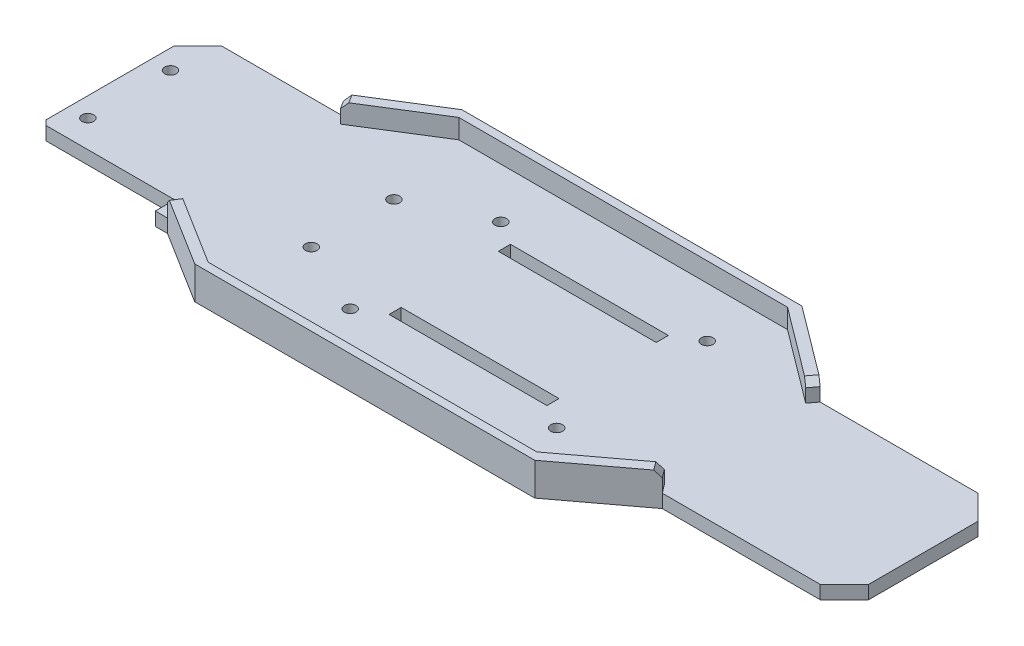
from build123d import *

# Parameters (mm, degrees)
BOSS_EXTRUDE1_DEPTH  = 5.5
CHASSIS_WALLS1_DEPTH = 8
CHAMFER1_SIZE        = 10
CHAMFER2_SIZE        = 10
CHAMFER3_SIZE        = 2.5
SKETCH4_R            = 2.4
CUT_EXTRUDE1_DEPTH   = 10
SKETCH5_W            = 55
SKETCH5_H            = 8
CUT_EXTRUDE2_DEPTH   = 10
SKETCH6_W            = 65
SKETCH6_H            = 5
CUT_EXTRUDE3_DEPTH   = 184.613724977


with BuildPart() as part:
    # Sketch1 → Boss-Extrude1 (new body)
    with BuildSketch(Plane(origin=(0, 0, 0), x_dir=(1, 0, 0), z_dir=(0, 1, 0))):
        Polygon((-100, 36.25), (-70, 55), (70, 55), (100, 32.5), (175, 32.5), (175, -32.5), (100, -32.5), (70, -55), (-70, -55), (-100, -36.25), (-160, -36.25), (-160, 36.25), align=None)
    extrude(amount=BOSS_EXTRUDE1_DEPTH)

    # Sketch3 → Chassis-Walls1 (add)
    with BuildSketch(Plane(origin=(0, 5.5, 0), x_dir=(1, 0, 0), z_dir=(0, 1, 0))):
        Polygon((0, 55), (-70, 55), (-100, 36.25), (-97.88000424, 32.858006784), (-67.88000424, 51.608006784), (0, 51.608006784), (67.456005088, 51.608006784), (97.456005088, 29.108006784), (100, 32.5), (70, 55), align=None)
        Polygon((67.456005088, -51.608006784), (0, -51.608006784), (-67.88000424, -51.608006784), (-97.88000424, -32.858006784), (-100, -36.25), (-70, -55), (0, -55), (70, -55), (100, -32.5), (97.456005088, -29.108006784), align=None)
    extrude(amount=CHASSIS_WALLS1_DEPTH)

    # Chamfer1
    chamfer1_edges = [part.edges().sort_by_distance(p)[0] for p in [
        (-160, 2.75, -36.25),
        (-160, 2.75, 36.25),
    ]]
    chamfer(chamfer1_edges, length=CHAMFER1_SIZE)

    # Chamfer2
    chamfer2_edges = [part.edges().sort_by_distance(p)[0] for p in [
        (175, 2.75, -32.5),
        (175, 2.75, 32.5),
    ]]
    chamfer(chamfer2_edges, length=CHAMFER2_SIZE)

    # Chamfer3
    chamfer3_edges = [part.edges().sort_by_distance(p)[0] for p in [
        (-98.94000212, 13.5, -34.554003392),
        (-98.94000212, 13.5, 34.554003392),
        (98.728002544, 13.5, 30.804003392),
        (98.728002544, 13.5, -30.804003392),
    ]]
    chamfer(chamfer3_edges, length=CHAMFER3_SIZE)

    # Sketch4 → Cut-Extrude1 (cut)
    with BuildSketch(Plane.XZ):
        with Locations((-152, 17)):
            Circle(SKETCH4_R)
        with Locations((-60, 17)):
            Circle(SKETCH4_R)
        with Locations((-60, -17)):
            Circle(SKETCH4_R)
        with Locations((-152, -17)):
            Circle(SKETCH4_R)
        with Locations((-30, 31)):
            Circle(SKETCH4_R)
        with Locations((55, 31)):
            Circle(SKETCH4_R)
        with Locations((55, -31)):
            Circle(SKETCH4_R)
        with Locations((-30, -31)):
            Circle(SKETCH4_R)
    extrude(amount=-CUT_EXTRUDE1_DEPTH, mode=Mode.SUBTRACT)

    # Sketch5 → Cut-Extrude2 (cut)
    with BuildSketch(Plane(origin=(0, 5.5, 0), x_dir=(1, 0, 0), z_dir=(0, 1, 0))):
        with Locations((-132.5, -32.25)):
            Rectangle(SKETCH5_W, SKETCH5_H)
    extrude(amount=-CUT_EXTRUDE2_DEPTH, mode=Mode.SUBTRACT)

    # Sketch6 → Cut-Extrude3 (cut, through all)
    with BuildSketch(Plane(origin=(0, 5.5, 0), x_dir=(1, 0, 0), z_dir=(0, 1, 0))):
        with Locations((12.5, 22.5)):
            Rectangle(SKETCH6_W, SKETCH6_H)
        with Locations((12.5, -22.5)):
            Rectangle(SKETCH6_W, SKETCH6_H)
    extrude(amount=-CUT_EXTRUDE3_DEPTH, mode=Mode.SUBTRACT)


solid = part.part
